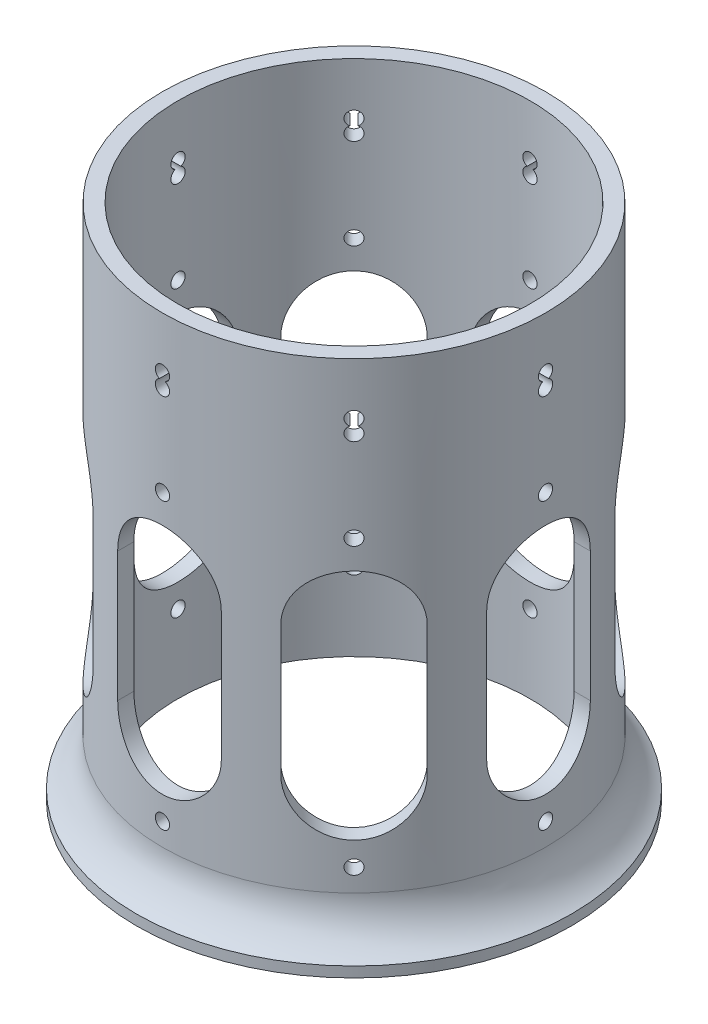
from build123d import *

# Parameters (mm, degrees)
SKETCH2_R                       = 37
SKETCH2_R_2                     = 34
MAIN_EXTRUDE_DEPTH              = 100
SKETCH3_R                       = 1.375
SCREWHOLE_DEPTH                 = 100
WEIGHT_REDUCTION_DEPTH          = 100
SCREWHOLE_PATTERN_COUNT         = 8
SKETCH5_R                       = 42
SKETCH5_R_2                     = 34
PLATE_FOR_BETTER_ADHESION_DEPTH = 2
FILLET1_R                       = 10


with BuildPart() as part:
    # Sketch2 → Main extrude (new body)
    with BuildSketch(Plane(origin=(0, 0, 0), x_dir=(1, 0, 0), z_dir=(0, 1, 0))):
        with Locations(Location((0, 0, 0), (0, 0, 270))):
            Circle(SKETCH2_R)
        with Locations(Location((0, 0, 0), (0, 0, 270))):
            Circle(SKETCH2_R_2, mode=Mode.SUBTRACT)
    extrude(amount=MAIN_EXTRUDE_DEPTH)

    # Sketch3 → Screwhole (cut)
    with BuildSketch(Plane.XY):
        with Locations(Location((0, 15, 0), (0, 0, 180))):
            Circle(SKETCH3_R)
        with Locations(Location((0, 70, 0), (0, 0, 180))):
            Circle(SKETCH3_R)
        with BuildLine():
            ThreePointArc((-0.572821962, 88.75), (0, 86.125), (0.572821962, 88.75))
            ThreePointArc((0.572821962, 88.75), (0, 91.375), (-0.572821962, 88.75))
        make_face()
    screwhole = extrude(amount=SCREWHOLE_DEPTH, mode=Mode.SUBTRACT)

    # Sketch4 → Weight reduction (cut)
    with BuildSketch(Plane.XY):
        with BuildLine():
            Line((10, 54.5), (10, 29.5))
            ThreePointArc((10, 29.5), (0, 19.5), (-10, 29.5))
            Line((-10, 29.5), (-10, 54.5))
            ThreePointArc((-10, 54.5), (0, 64.5), (10, 54.5))
        make_face()
    weight_reduction = extrude(amount=WEIGHT_REDUCTION_DEPTH, mode=Mode.SUBTRACT)

    # Screwhole pattern: Screwhole, Weight reduction ×8 about axis
    screwhole_pattern_axis = Axis((0, 0, 0), (0, 1, 0))
    add([screwhole.rotate(screwhole_pattern_axis, i * 360 / SCREWHOLE_PATTERN_COUNT) for i in range(1, SCREWHOLE_PATTERN_COUNT)], mode=Mode.SUBTRACT)
    add([weight_reduction.rotate(screwhole_pattern_axis, i * 360 / SCREWHOLE_PATTERN_COUNT) for i in range(1, SCREWHOLE_PATTERN_COUNT)], mode=Mode.SUBTRACT)

    # Sketch5 → Plate for better adhesion (add)
    with BuildSketch(Plane.XZ):
        with Locations(Location((0, 0, 0), (0, 0, 270))):
            Circle(SKETCH5_R)
        with Locations(Location((0, 0, 0), (0, 0, 90))):
            Circle(SKETCH5_R_2, mode=Mode.SUBTRACT)
    extrude(amount=-PLATE_FOR_BETTER_ADHESION_DEPTH)

    # Fillet1
    # the kernel refuses this fillet: 10 mm, written as the material it adds along each edge
    with BuildSketch(Plane(origin=(0, 2, 0), x_dir=(0, 0, 1), z_dir=(1, 0, 0))) as fillet1_piece_1:
        with BuildLine():
            CenterArc((47, -8.660254038), FILLET1_R, 120, 60)
            Line((37, -8.660254038), (36.8, -8.660254038))
            Line((36.8, -8.660254038), (36.8, 0))
            Line((36.8, 0), (37, 0.2))
            ThreePointArc((37, 0.2), (39.5, 0.2), (41.9, 0.173205081))
            Line((41.9, 0.173205081), (42, 0))
        make_face()
    revolve(axis=Axis((0, 2, 0), (0, -1, 0)))


solid = part.part
